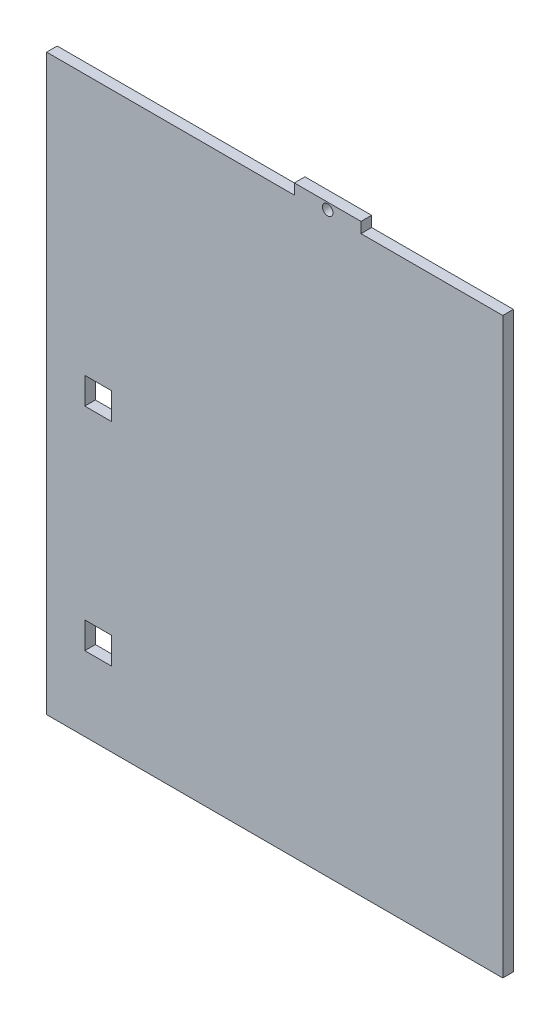
from build123d import *

# Parameters (mm, degrees)
SKETCH1_W           = 136.85
SKETCH1_H           = 175.31
BOSS_EXTRUDE1_DEPTH = 3.18
SKETCH2_W           = 8
SKETCH2_H           = 8
CUT_EXTRUDE1_DEPTH  = 112.245188885
SKETCH3_R           = 1.59
SKETCH3_W           = 74.32
SKETCH3_H           = 3.18
SKETCH3_W_2         = 42.53
CUT_EXTRUDE2_DEPTH  = 10


with BuildPart() as part:
    # Sketch1 → Boss-Extrude1 (new body)
    with BuildSketch(Plane.XY):
        Rectangle(SKETCH1_W, SKETCH1_H)
    extrude(amount=BOSS_EXTRUDE1_DEPTH)

    # Sketch2 → Cut-Extrude1 (cut, through all)
    with BuildSketch(Plane.XY.offset(3.18)):
        with Locations((-52.983317413, 2.233249723)):
            Rectangle(SKETCH2_W, SKETCH2_H)
        with Locations((-52.983317413, -61.311545429)):
            Rectangle(SKETCH2_W, SKETCH2_H)
    extrude(amount=-CUT_EXTRUDE1_DEPTH, mode=Mode.SUBTRACT)

    # Sketch3 → Cut-Extrude2 (cut)
    with BuildSketch(Plane.XY.offset(3.18)):
        with Locations((15.89952905, 85.655)):
            Circle(SKETCH3_R)
        with Locations((-31.265, 86.065)):
            Rectangle(SKETCH3_W, SKETCH3_H)
        with Locations((47.16, 86.065)):
            Rectangle(SKETCH3_W_2, SKETCH3_H)
    extrude(amount=-CUT_EXTRUDE2_DEPTH, mode=Mode.SUBTRACT)


solid = part.part
